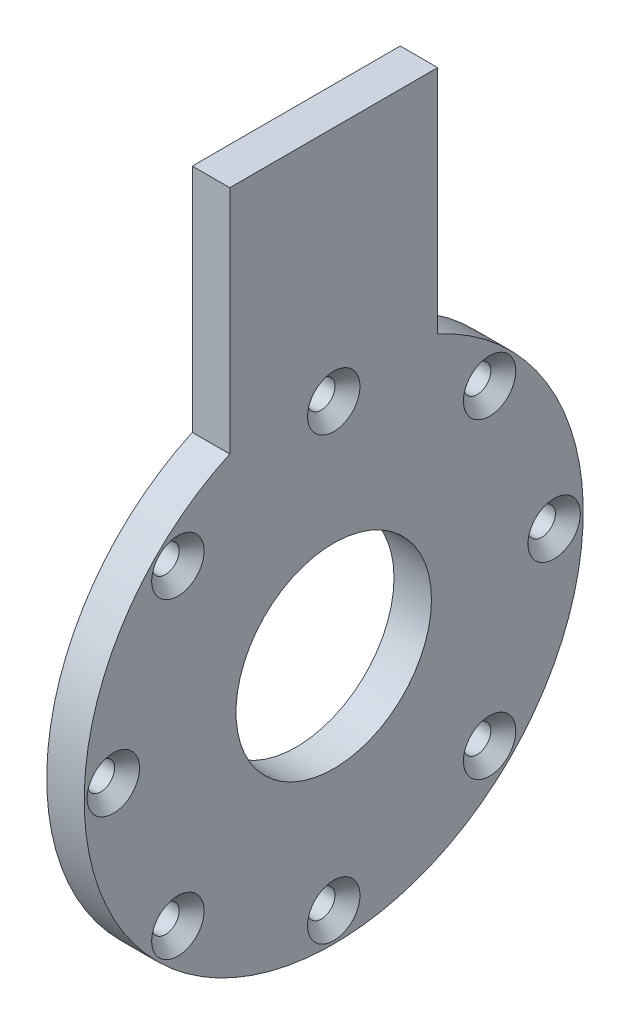
from build123d import *

# Parameters (mm, degrees)
BOSS_EXTRUDE1_DEPTH                                 = 9
BOSS_EXTRUDE1_DEPTH_BACK                            = 0.01
SKETCH1_R                                           = 23.5
CSK_FOR_M6_COUNTERSUNK_FLAT_HEAD_SCREW1_D           = 6.6
CSK_FOR_M6_COUNTERSUNK_FLAT_HEAD_SCREW1_CSINK_D     = 12.6
CSK_FOR_M6_COUNTERSUNK_FLAT_HEAD_SCREW1_CSINK_ANGLE = 90


with BuildPart() as part:
    # Sketch1 → Boss-Extrude1 (new, two sides: drawn at the far end of the back side and taken through both)
    with BuildSketch(Plane(origin=(0, 0, 0), x_dir=(0, 0, -1), z_dir=(1, 0, 0)).offset(-BOSS_EXTRUDE1_DEPTH_BACK)):
        with BuildLine():
            Line((-25, 110), (25, 110))
            Line((25, 110), (25, 54.543560573))
            ThreePointArc((25, 54.543560573), (0, -60), (-25, 54.543560573))
            Line((-25, 54.543560573), (-25, 110))
        make_face()
        Circle(SKETCH1_R, mode=Mode.SUBTRACT)
    extrude(amount=BOSS_EXTRUDE1_DEPTH + BOSS_EXTRUDE1_DEPTH_BACK)

    # CSK for M6 Countersunk Flat Head Screw1 (through all)
    with Locations(Plane(origin=(9, 0, 0), x_dir=(0, 0, -1), z_dir=(1, 0, 0))):
        with Locations((-37.476659403, 37.476659403), (0, 53), (37.476659403, 37.476659403), (53, 0), (37.476659403, -37.476659403), (0, -53), (-37.476659403, -37.476659403), (-53, 0)):
            CounterSinkHole(CSK_FOR_M6_COUNTERSUNK_FLAT_HEAD_SCREW1_D / 2, CSK_FOR_M6_COUNTERSUNK_FLAT_HEAD_SCREW1_CSINK_D / 2, counter_sink_angle=CSK_FOR_M6_COUNTERSUNK_FLAT_HEAD_SCREW1_CSINK_ANGLE)


solid = part.part
